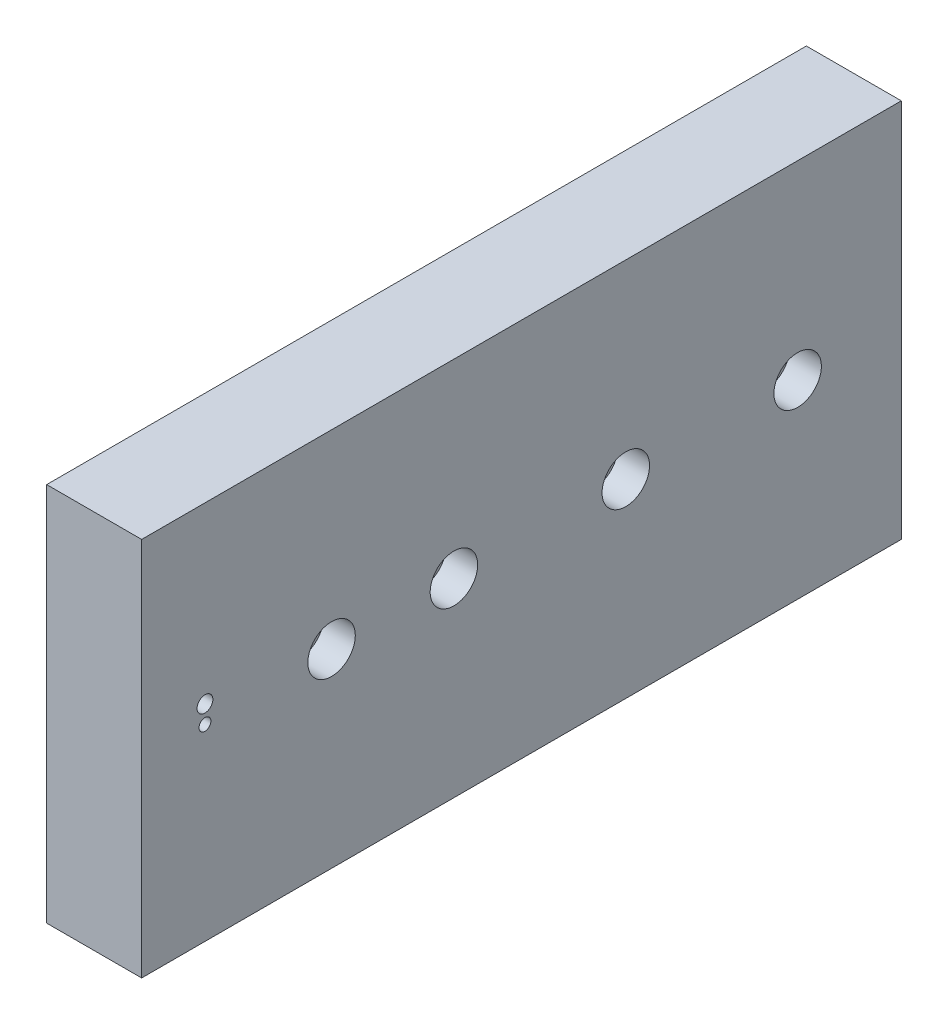
from build123d import *

# Parameters (mm, degrees)
SKETCH1_W           = 152.4
SKETCH1_H           = 76.2
SKETCH1_R           = 1.5875
SKETCH1_R_2         = 1.190625
BOSS_EXTRUDE1_DEPTH = 19.05
SKETCH3_R           = 4.7625
CUT_EXTRUDE2_DEPTH  = 6.35


with BuildPart() as part:
    # Sketch1 → Boss-Extrude1 (new body)
    with BuildSketch(Plane(origin=(0, 0, 0), x_dir=(0, 0, -1), z_dir=(1, 0, 0))):
        Rectangle(SKETCH1_W, SKETCH1_H)
        with Locations(Location((-38.1, 0, 0), (0, 0, 180))):
            Circle(SKETCH1_R, mode=Mode.SUBTRACT)
        with Locations(Location((-13.55, 0, 0), (0, 0, 180))):
            Circle(SKETCH1_R, mode=Mode.SUBTRACT)
        with Locations(Location((20.927, 0, 0), (0, 0, 180))):
            Circle(SKETCH1_R, mode=Mode.SUBTRACT)
        with Locations(Location((55.404, 0, 0), (0, 0, 180))):
            Circle(SKETCH1_R, mode=Mode.SUBTRACT)
        with Locations(Location((-63.5, -0.396875, 0), (0, 0, 180))):
            Circle(SKETCH1_R_2, mode=Mode.SUBTRACT)
        with Locations(Location((-63.5, 3.175, 0), (0, 0, 180))):
            Circle(SKETCH1_R, mode=Mode.SUBTRACT)
    extrude(amount=BOSS_EXTRUDE1_DEPTH)

    # Sketch3 → Cut-Extrude2 (cut)
    with BuildSketch(Plane(origin=(19.05, 0, 0), x_dir=(0, 0, -1), z_dir=(1, 0, 0))):
        with Locations((-38.1, 0)):
            Circle(SKETCH3_R)
        with Locations((-13.55, 0)):
            Circle(SKETCH3_R)
        with Locations((20.927, 0)):
            Circle(SKETCH3_R)
        with Locations((55.404, 0)):
            Circle(SKETCH3_R)
    extrude(amount=-CUT_EXTRUDE2_DEPTH, mode=Mode.SUBTRACT)

    # 1/4 (0.25) Diameter Hole1: read off the stored shape, not the designer's step
    # 1/4 (0.25) Diameter Hole1 outline → 1/4 (0.25) Diameter Hole1 (revolve, cut)
    with BuildSketch(Plane(origin=(9.525, 0, 57.15), x_dir=(1, 0, 0), z_dir=(0, 0, 1))):
        Polygon((3.175, -25.4), (0, -23.492267535), (0, -38.1), (3.175, -38.1), align=None)
    revolve(axis=Axis((9.525, 0, 57.15), (0, 1, 0)), mode=Mode.SUBTRACT)

    # 1_4 _0.25_ Diameter Hole1 2 outline → 1_4 _0.25_ Diameter Hole1 2 (revolve, cut)
    with BuildSketch(Plane(origin=(9.525, 0, 0), x_dir=(1, 0, 0), z_dir=(0, 0, 1))):
        Polygon((3.175, -25.4), (0, -23.492267535), (0, -38.1), (3.175, -38.1), align=None)
    revolve(axis=Axis((9.525, 0, 0), (0, 1, 0)), mode=Mode.SUBTRACT)

    # 1_4 _0.25_ Diameter Hole1 3 outline → 1_4 _0.25_ Diameter Hole1 3 (revolve, cut)
    with BuildSketch(Plane(origin=(9.525, 0, -63.5), x_dir=(1, 0, 0), z_dir=(0, 0, 1))):
        Polygon((3.175, -25.4), (0, -23.492267535), (0, -38.1), (3.175, -38.1), align=None)
    revolve(axis=Axis((9.525, 0, -63.5), (0, 1, 0)), mode=Mode.SUBTRACT)


solid = part.part
